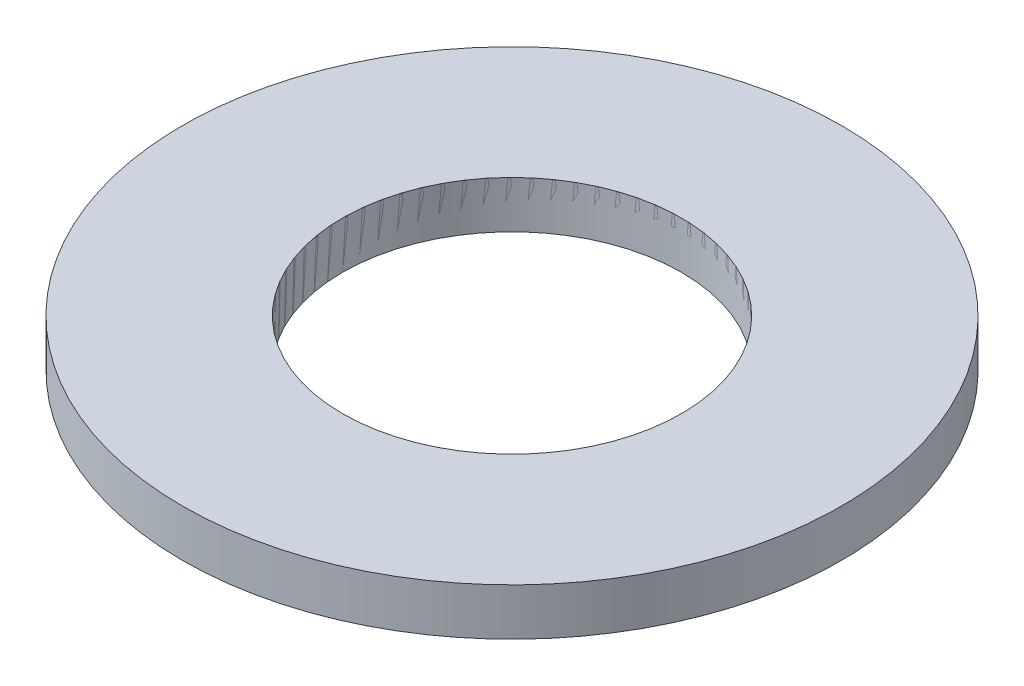
from build123d import *

# Parameters (mm, degrees)
SKETCH1_R               = 1750
BOSS_EXTRUDE1_DEPTH     = 500
SKETCH2_R               = 900
CUT_EXTRUDE2_DEPTH      = 300
SKETCH3_R               = 600
CUT_EXTRUDE3_DEPTH      = 300
SKETCH4_R               = 1748.5
SKETCH4_R_2             = 900.75
CUT_EXTRUDE5_DEPTH      = 497
CUT_EXTRUDE6_DEPTH      = 2525.876234591
CUT_EXTRUDE6_DEPTH_BACK = 2525.876234591
SKETCH5_W               = 3500
SKETCH5_H               = 250


with BuildPart() as part:
    # Sketch1 → Boss-Extrude1 (new body)
    with BuildSketch(Plane(origin=(0, 0, 0), x_dir=(1, 0, 0), z_dir=(0, 1, 0))):
        Circle(SKETCH1_R)
    extrude(amount=BOSS_EXTRUDE1_DEPTH)

    # Sketch2 → Cut-Extrude2 (cut)
    with BuildSketch(Plane(origin=(0, 500, 0), x_dir=(1, 0, 0), z_dir=(0, 1, 0))):
        Circle(SKETCH2_R)
    extrude(amount=-CUT_EXTRUDE2_DEPTH, mode=Mode.SUBTRACT)

    # Sketch3 → Cut-Extrude3 (cut)
    with BuildSketch(Plane.XZ):
        Circle(SKETCH3_R)
    extrude(amount=-CUT_EXTRUDE3_DEPTH, mode=Mode.SUBTRACT)

    # Sketch4 → Cut-Extrude5 (cut)
    with BuildSketch(Plane(origin=(0, 0, 0), x_dir=(-1, 0, 0), z_dir=(0, -1, 0))):
        Circle(SKETCH4_R)
        Circle(SKETCH4_R_2, mode=Mode.SUBTRACT)
    extrude(amount=-CUT_EXTRUDE5_DEPTH, mode=Mode.SUBTRACT)

    # Sketch5 → Cut-Extrude6 (cut, two sides: drawn at the far end of the back side and taken through both)
    with BuildSketch(Plane.XY.offset(-CUT_EXTRUDE6_DEPTH_BACK)):
        with Locations((0, 125)):
            Rectangle(SKETCH5_W, SKETCH5_H)
    extrude(amount=CUT_EXTRUDE6_DEPTH + CUT_EXTRUDE6_DEPTH_BACK, mode=Mode.SUBTRACT)


solid = part.part
